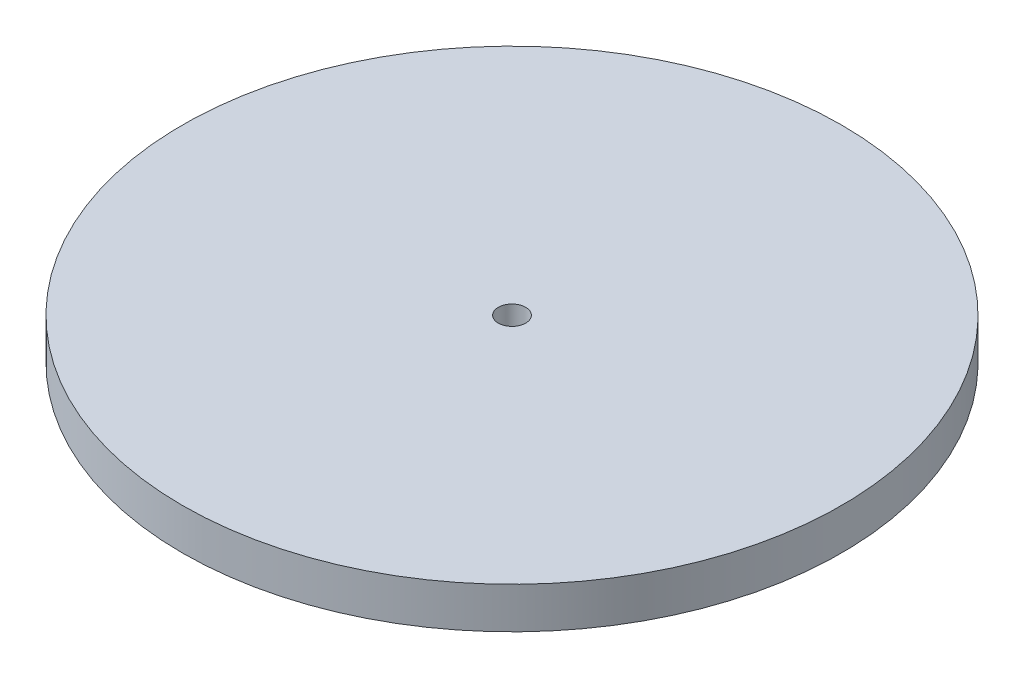
from build123d import *

# Parameters (mm, degrees)
SKETCH1_R           = 76.2
SKETCH1_R_2         = 3.175
BOSS_EXTRUDE1_DEPTH = 9.525


with BuildPart() as part:
    # Sketch1 → Boss-Extrude1 (new body)
    with BuildSketch(Plane(origin=(0, 0, 0), x_dir=(1, 0, 0), z_dir=(0, 1, 0))):
        Circle(SKETCH1_R)
        Circle(SKETCH1_R_2, mode=Mode.SUBTRACT)
    extrude(amount=BOSS_EXTRUDE1_DEPTH)


solid = part.part
